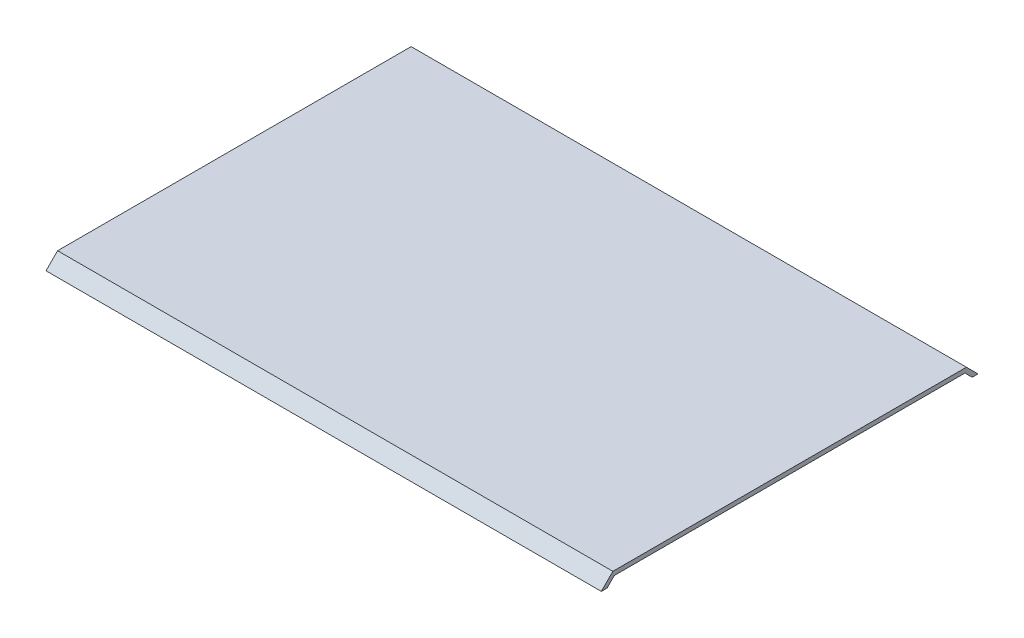
from build123d import *

# Parameters (mm, degrees)
BOSS_EXTRUDE1_DEPTH = 243.332
SKETCH2_W           = 114.3
SKETCH2_H           = 161.266666628
SKETCH2_W_2         = 78.232
SKETCH2_W_3         = 25.4
CUT_EXTRUDE1_DEPTH  = 3.175
CUT_EXTRUDE2_DEPTH  = 4.233333333
CHAMFER4_SIZE       = 0.635
CHAMFER3_SIZE       = 3.81
CHAMFER2_SIZE       = 5.08


# Some blends are built 0.0001 mm under size
with BuildPart() as part:
    # Sketch1 → Boss-Extrude1 (new body)
    with BuildSketch(Plane(origin=(0, 0, 0), x_dir=(0, 0, -1), z_dir=(1, 0, 0))):
        Polygon((-82.538333314, 2.54), (82.538333314, 2.54), (82.538333314, -2.54), (71.108333314, -2.54), (71.108333314, 0.635), (-71.108333314, 0.635), (-71.108333314, -2.54), (-82.538333314, -2.54), align=None)
    extrude(amount=BOSS_EXTRUDE1_DEPTH)

    # Sketch2 → Cut-Extrude1 (cut)
    with BuildSketch(Plane.XZ.offset(2.54)):
        with Locations((65.616666667, 0)):
            Rectangle(SKETCH2_W, SKETCH2_H)
        with Locations((170.349333333, 0)):
            Rectangle(SKETCH2_W_2, SKETCH2_H)
        with Locations((230.632, 0)):
            Rectangle(SKETCH2_W_3, SKETCH2_H)
    extrude(amount=-CUT_EXTRUDE1_DEPTH, mode=Mode.SUBTRACT)

    # Sketch4 → Cut-Extrude2 (cut)
    with BuildSketch(Plane.XZ.offset(2.54)):
        Polygon((4.233333333, 78.516666648), (7.408333333, 75.341666648), (4.233333333, 72.166666648), (1.058333333, 75.341666648), align=None)
        Polygon((210.523666667, 75.341666648), (213.698666667, 78.516666648), (216.873666667, 75.341666648), (213.698666667, 72.166666648), align=None)
        Polygon((123.825, 75.341666648), (127, 78.516666648), (130.175, 75.341666648), (127, 72.166666648), align=None)
        Polygon((1.058333333, -75.341666648), (4.233333333, -72.166666648), (7.408333333, -75.341666648), (4.233333333, -78.516666648), align=None)
        Polygon((123.825, -75.341666648), (127, -72.166666648), (130.175, -75.341666648), (127, -78.516666648), align=None)
        Polygon((210.523666667, -75.341666648), (213.698666667, -72.166666648), (216.873666667, -75.341666648), (213.698666667, -78.516666648), align=None)
    extrude(amount=-CUT_EXTRUDE2_DEPTH, mode=Mode.SUBTRACT)

    # Chamfer4
    chamfer4_edges = [part.edges().sort_by_distance(p)[0] for p in [
        (125.4125, 1.693333333, 73.754166648),
        (125.4125, 1.693333333, 76.929166648),
        (128.5875, 1.693333333, 76.929166648),
        (128.5875, 1.693333333, 73.754166648),
        (125.4125, -2.54, 73.754166648),
        (128.5875, -2.54, 73.754166648),
        (128.5875, -2.54, 76.929166648),
        (125.4125, -2.54, 76.929166648),
        (212.111166667, 1.693333333, 73.754166648),
        (212.111166667, 1.693333333, 76.929166648),
        (215.286166667, 1.693333333, 76.929166648),
        (215.286166667, 1.693333333, 73.754166648),
        (212.111166667, -2.54, 73.754166648),
        (215.286166667, -2.54, 73.754166648),
        (215.286166667, -2.54, 76.929166648),
        (212.111166667, -2.54, 76.929166648),
        (2.645833333, 1.693333333, -76.929166648),
        (2.645833333, 1.693333333, -73.754166648),
        (5.820833333, 1.693333333, -73.754166648),
        (5.820833333, 1.693333333, -76.929166648),
        (2.645833333, -2.54, -76.929166648),
        (5.820833333, -2.54, -76.929166648),
        (5.820833333, -2.54, -73.754166648),
        (2.645833333, -2.54, -73.754166648),
        (125.4125, 1.693333333, -76.929166648),
        (125.4125, 1.693333333, -73.754166648),
        (128.5875, 1.693333333, -73.754166648),
        (128.5875, 1.693333333, -76.929166648),
        (125.4125, -2.54, -76.929166648),
        (128.5875, -2.54, -76.929166648),
        (128.5875, -2.54, -73.754166648),
        (125.4125, -2.54, -73.754166648),
        (212.111166667, 1.693333333, -76.929166648),
        (212.111166667, 1.693333333, -73.754166648),
        (215.286166667, 1.693333333, -73.754166648),
        (215.286166667, 1.693333333, -76.929166648),
        (212.111166667, -2.54, -76.929166648),
        (215.286166667, -2.54, -76.929166648),
        (215.286166667, -2.54, -73.754166648),
        (212.111166667, -2.54, -73.754166648),
        (2.645833333, 1.693333333, 76.929166648),
        (5.820833333, 1.693333333, 76.929166648),
        (5.820833333, 1.693333333, 73.754166648),
        (2.645833333, 1.693333333, 73.754166648),
        (2.645833333, -2.54, 76.929166648),
        (2.645833333, -2.54, 73.754166648),
        (5.820833333, -2.54, 73.754166648),
        (5.820833333, -2.54, 76.929166648),
    ]]
    chamfer(chamfer4_edges, length=CHAMFER4_SIZE)

    # Chamfer3
    # the kernel refuses this chamfer: 3.81 mm, written as the material it adds along each edge
    with BuildSketch(Plane(origin=(132.564778851, 0.635, -80.633333314), x_dir=(0, 0.027495876610586334, 0.9996219169112968), z_dir=(-1, 0, 0))) as chamfer3_piece_1_section:
        Polygon((CHAMFER3_SIZE * 0.999621916911, -CHAMFER3_SIZE * 0.0274958766106), (-CHAMFER3_SIZE * 0.0274958766106, -CHAMFER3_SIZE * 0.999621916911), (0, 0), align=None)
    chamfer3_piece_1 = extrude(amount=133.896224368, mode=Mode.PRIVATE)
    chamfer3_piece_1 = split(chamfer3_piece_1, bisect_by=Plane(origin=(131.899056092, -2.54, -79.333095219), z_dir=(0, 1, 0)), keep=Keep.TOP, mode=Mode.PRIVATE)
    chamfer3_piece_1 = split(chamfer3_piece_1, bisect_by=Plane(origin=(129.04131376, -0.57452381, -76.475352887), z_dir=(0.7071067811865444, 0, -0.7071067811865507)), keep=Keep.TOP, mode=Mode.PRIVATE)
    add(chamfer3_piece_1)
    with BuildSketch(Plane(origin=(132.564778851, 0.635, -80.633333314), x_dir=(0, 0.027495876610586334, 0.9996219169112968), z_dir=(-1, 0, 0))) as chamfer3_piece_2_section:
        Polygon((CHAMFER3_SIZE * 0.999621916911, -CHAMFER3_SIZE * 0.0274958766106), (-CHAMFER3_SIZE * 0.0274958766106, -CHAMFER3_SIZE * 0.999621916911), (0, 0), align=None)
    chamfer3_piece_2 = extrude(amount=133.896224368, mode=Mode.PRIVATE)
    chamfer3_piece_2 = split(chamfer3_piece_2, bisect_by=Plane(origin=(65.616666667, -2.54, -79.333095219), z_dir=(0, 1, 0)), keep=Keep.TOP, mode=Mode.PRIVATE)
    chamfer3_piece_2 = split(chamfer3_piece_2, bisect_by=Plane(origin=(34.516785714, -0.57452381, -48.233214267), z_dir=(0.7071067811865476, 0, -0.7071067811865476)), keep=Keep.TOP, mode=Mode.PRIVATE)
    chamfer3_piece_2 = split(chamfer3_piece_2, bisect_by=Plane(origin=(96.716547619, -0.57452381, -48.233214267), z_dir=(-0.7071067811865444, 0, -0.7071067811865507)), keep=Keep.TOP, mode=Mode.PRIVATE)
    add(chamfer3_piece_2)
    with BuildSketch(Plane(origin=(219.263445517, 0.635, -80.633333314), x_dir=(0, 0.027495876610586334, 0.9996219169112968), z_dir=(-1, 0, 0))) as chamfer3_piece_3_section:
        Polygon((CHAMFER3_SIZE * 0.999621916911, -CHAMFER3_SIZE * 0.0274958766106), (-CHAMFER3_SIZE * 0.0274958766106, -CHAMFER3_SIZE * 0.999621916911), (0, 0), align=None)
    chamfer3_piece_3 = extrude(amount=97.828224368, mode=Mode.PRIVATE)
    chamfer3_piece_3 = split(chamfer3_piece_3, bisect_by=Plane(origin=(218.597722759, -2.54, -79.333095219), z_dir=(0, 1, 0)), keep=Keep.TOP, mode=Mode.PRIVATE)
    chamfer3_piece_3 = split(chamfer3_piece_3, bisect_by=Plane(origin=(215.739980427, -0.57452381, -76.475352887), z_dir=(0.7071067811865507, 0, -0.7071067811865444)), keep=Keep.TOP, mode=Mode.PRIVATE)
    add(chamfer3_piece_3)
    with BuildSketch(Plane(origin=(219.263445517, 0.635, -80.633333314), x_dir=(0, 0.027495876610586334, 0.9996219169112968), z_dir=(-1, 0, 0))) as chamfer3_piece_4_section:
        Polygon((CHAMFER3_SIZE * 0.999621916911, -CHAMFER3_SIZE * 0.0274958766106), (-CHAMFER3_SIZE * 0.0274958766106, -CHAMFER3_SIZE * 0.999621916911), (0, 0), align=None)
    chamfer3_piece_4 = extrude(amount=97.828224368, mode=Mode.PRIVATE)
    chamfer3_piece_4 = split(chamfer3_piece_4, bisect_by=Plane(origin=(170.349333333, -2.54, -79.333095219), z_dir=(0, 1, 0)), keep=Keep.TOP, mode=Mode.PRIVATE)
    chamfer3_piece_4 = split(chamfer3_piece_4, bisect_by=Plane(origin=(148.266452381, -0.57452381, -57.250214267), z_dir=(0.7071067811865444, 0, -0.7071067811865507)), keep=Keep.TOP, mode=Mode.PRIVATE)
    chamfer3_piece_4 = split(chamfer3_piece_4, bisect_by=Plane(origin=(192.432214286, -0.57452381, -57.250214267), z_dir=(-0.7071067811865507, 0, -0.7071067811865444)), keep=Keep.TOP, mode=Mode.PRIVATE)
    add(chamfer3_piece_4)
    with BuildSketch(Plane(origin=(219.263445517, 0.635, -80.633333314), x_dir=(0, 0.027495876610586334, 0.9996219169112968), z_dir=(-1, 0, 0))) as chamfer3_piece_5_section:
        Polygon((CHAMFER3_SIZE * 0.999621916911, -CHAMFER3_SIZE * 0.0274958766106), (-CHAMFER3_SIZE * 0.0274958766106, -CHAMFER3_SIZE * 0.999621916911), (0, 0), align=None)
    chamfer3_piece_5 = extrude(amount=97.828224368, mode=Mode.PRIVATE)
    chamfer3_piece_5 = split(chamfer3_piece_5, bisect_by=Plane(origin=(122.100943908, -2.54, -79.333095219), z_dir=(0, 1, 0)), keep=Keep.TOP, mode=Mode.PRIVATE)
    chamfer3_piece_5 = split(chamfer3_piece_5, bisect_by=Plane(origin=(124.95868624, -0.57452381, -76.475352887), z_dir=(-0.7071067811865444, 0, -0.7071067811865507)), keep=Keep.TOP, mode=Mode.PRIVATE)
    add(chamfer3_piece_5)
    with BuildSketch(Plane(origin=(243.332, 0.635, -80.633333314), x_dir=(0, 0.027495876610580335, 0.999621916911297), z_dir=(-1, 0, 0))) as chamfer3_piece_6_section:
        Polygon((CHAMFER3_SIZE * 0.999621916911, -CHAMFER3_SIZE * 0.0274958766106), (-CHAMFER3_SIZE * 0.0274958766106, -CHAMFER3_SIZE * 0.999621916911), (0, 0), align=None)
    chamfer3_piece_6 = extrude(amount=35.198112184, mode=Mode.PRIVATE)
    chamfer3_piece_6 = split(chamfer3_piece_6, bisect_by=Plane(origin=(230.632, -2.54, -79.333095219), z_dir=(0, 1, 0)), keep=Keep.TOP, mode=Mode.PRIVATE)
    chamfer3_piece_6 = split(chamfer3_piece_6, bisect_by=Plane(origin=(221.757119048, -0.57452381, -70.458214267), z_dir=(0.7071067811865507, 0, -0.7071067811865444)), keep=Keep.TOP, mode=Mode.PRIVATE)
    add(chamfer3_piece_6)
    with BuildSketch(Plane(origin=(253.130112184, 0.635, -80.633333314), x_dir=(0, 0.027495876610586334, 0.9996219169112968), z_dir=(-1, 0, 0))) as chamfer3_piece_7_section:
        Polygon((CHAMFER3_SIZE * 0.999621916911, -CHAMFER3_SIZE * 0.0274958766106), (-CHAMFER3_SIZE * 0.0274958766106, -CHAMFER3_SIZE * 0.999621916911), (0, 0), align=None)
    chamfer3_piece_7 = extrude(amount=44.996224368, mode=Mode.PRIVATE)
    chamfer3_piece_7 = split(chamfer3_piece_7, bisect_by=Plane(origin=(208.799610575, -2.54, -79.333095219), z_dir=(0, 1, 0)), keep=Keep.TOP, mode=Mode.PRIVATE)
    chamfer3_piece_7 = split(chamfer3_piece_7, bisect_by=Plane(origin=(211.657352906, -0.57452381, -76.475352887), z_dir=(-0.7071067811865507, 0, -0.7071067811865444)), keep=Keep.TOP, mode=Mode.PRIVATE)
    add(chamfer3_piece_7)
    with BuildSketch(Plane(origin=(208.133887816, 0.635, 80.633333314), x_dir=(0, -0.9996219169112968, 0.027495876610586382), z_dir=(1, 0, 0))) as chamfer3_piece_8_section:
        Polygon((CHAMFER3_SIZE * 0.999621916911, CHAMFER3_SIZE * 0.0274958766106), (-CHAMFER3_SIZE * 0.0274958766106, CHAMFER3_SIZE * 0.999621916911), (0, 0), align=None)
    chamfer3_piece_8 = extrude(amount=44.996224368, mode=Mode.PRIVATE)
    chamfer3_piece_8 = split(chamfer3_piece_8, bisect_by=Plane(origin=(208.799610575, -2.54, 79.333095219), z_dir=(0, 1, 0)), keep=Keep.TOP, mode=Mode.PRIVATE)
    chamfer3_piece_8 = split(chamfer3_piece_8, bisect_by=Plane(origin=(211.657352906, -0.57452381, 76.475352887), z_dir=(-0.7071067811865301, 0, 0.7071067811865649)), keep=Keep.TOP, mode=Mode.PRIVATE)
    add(chamfer3_piece_8)
    with BuildSketch(Plane(origin=(208.133887816, 0.635, 80.633333314), x_dir=(0, -0.9996219169112968, 0.027495876610586382), z_dir=(1, 0, 0))) as chamfer3_piece_9_section:
        Polygon((CHAMFER3_SIZE * 0.999621916911, CHAMFER3_SIZE * 0.0274958766106), (-CHAMFER3_SIZE * 0.0274958766106, CHAMFER3_SIZE * 0.999621916911), (0, 0), align=None)
    chamfer3_piece_9 = extrude(amount=35.198112184, mode=Mode.PRIVATE)
    chamfer3_piece_9 = split(chamfer3_piece_9, bisect_by=Plane(origin=(230.632, -2.54, 79.333095219), z_dir=(0, 1, 0)), keep=Keep.TOP, mode=Mode.PRIVATE)
    chamfer3_piece_9 = split(chamfer3_piece_9, bisect_by=Plane(origin=(221.757119048, -0.57452381, 70.458214267), z_dir=(0.7071067811865619, 0, 0.7071067811865334)), keep=Keep.TOP, mode=Mode.PRIVATE)
    add(chamfer3_piece_9)
    with BuildSketch(Plane(origin=(121.435221149, 0.635, 80.633333314), x_dir=(0, -0.9996219169112968, 0.027495876610586382), z_dir=(1, 0, 0))) as chamfer3_piece_10_section:
        Polygon((CHAMFER3_SIZE * 0.999621916911, CHAMFER3_SIZE * 0.0274958766106), (-CHAMFER3_SIZE * 0.0274958766106, CHAMFER3_SIZE * 0.999621916911), (0, 0), align=None)
    chamfer3_piece_10 = extrude(amount=97.828224368, mode=Mode.PRIVATE)
    chamfer3_piece_10 = split(chamfer3_piece_10, bisect_by=Plane(origin=(122.100943908, -2.54, 79.333095219), z_dir=(0, 1, 0)), keep=Keep.TOP, mode=Mode.PRIVATE)
    chamfer3_piece_10 = split(chamfer3_piece_10, bisect_by=Plane(origin=(124.95868624, -0.57452381, 76.475352887), z_dir=(-0.7071067811865476, 0, 0.7071067811865476)), keep=Keep.TOP, mode=Mode.PRIVATE)
    add(chamfer3_piece_10)
    with BuildSketch(Plane(origin=(121.435221149, 0.635, 80.633333314), x_dir=(0, -0.9996219169112968, 0.027495876610586382), z_dir=(1, 0, 0))) as chamfer3_piece_11_section:
        Polygon((CHAMFER3_SIZE * 0.999621916911, CHAMFER3_SIZE * 0.0274958766106), (-CHAMFER3_SIZE * 0.0274958766106, CHAMFER3_SIZE * 0.999621916911), (0, 0), align=None)
    chamfer3_piece_11 = extrude(amount=97.828224368, mode=Mode.PRIVATE)
    chamfer3_piece_11 = split(chamfer3_piece_11, bisect_by=Plane(origin=(170.349333333, -2.54, 79.333095219), z_dir=(0, 1, 0)), keep=Keep.TOP, mode=Mode.PRIVATE)
    chamfer3_piece_11 = split(chamfer3_piece_11, bisect_by=Plane(origin=(148.266452381, -0.57452381, 57.250214267), z_dir=(0.7071067811865459, 0, 0.7071067811865491)), keep=Keep.TOP, mode=Mode.PRIVATE)
    chamfer3_piece_11 = split(chamfer3_piece_11, bisect_by=Plane(origin=(192.432214286, -0.57452381, 57.250214267), z_dir=(-0.7071067811865301, 0, 0.7071067811865649)), keep=Keep.TOP, mode=Mode.PRIVATE)
    add(chamfer3_piece_11)
    with BuildSketch(Plane(origin=(121.435221149, 0.635, 80.633333314), x_dir=(0, -0.9996219169112968, 0.027495876610586382), z_dir=(1, 0, 0))) as chamfer3_piece_12_section:
        Polygon((CHAMFER3_SIZE * 0.999621916911, CHAMFER3_SIZE * 0.0274958766106), (-CHAMFER3_SIZE * 0.0274958766106, CHAMFER3_SIZE * 0.999621916911), (0, 0), align=None)
    chamfer3_piece_12 = extrude(amount=97.828224368, mode=Mode.PRIVATE)
    chamfer3_piece_12 = split(chamfer3_piece_12, bisect_by=Plane(origin=(218.597722759, -2.54, 79.333095219), z_dir=(0, 1, 0)), keep=Keep.TOP, mode=Mode.PRIVATE)
    chamfer3_piece_12 = split(chamfer3_piece_12, bisect_by=Plane(origin=(215.739980427, -0.57452381, 76.475352887), z_dir=(0.7071067811865619, 0, 0.7071067811865334)), keep=Keep.TOP, mode=Mode.PRIVATE)
    add(chamfer3_piece_12)
    with BuildSketch(Plane(origin=(-1.331445517, 0.635, 80.633333314), x_dir=(0, -0.9996219169112968, 0.027495876610586382), z_dir=(1, 0, 0))) as chamfer3_piece_13_section:
        Polygon((CHAMFER3_SIZE * 0.999621916911, CHAMFER3_SIZE * 0.0274958766106), (-CHAMFER3_SIZE * 0.0274958766106, CHAMFER3_SIZE * 0.999621916911), (0, 0), align=None)
    chamfer3_piece_13 = extrude(amount=133.896224368, mode=Mode.PRIVATE)
    chamfer3_piece_13 = split(chamfer3_piece_13, bisect_by=Plane(origin=(65.616666667, -2.54, 79.333095219), z_dir=(0, 1, 0)), keep=Keep.TOP, mode=Mode.PRIVATE)
    chamfer3_piece_13 = split(chamfer3_piece_13, bisect_by=Plane(origin=(96.716547619, -0.57452381, 48.233214267), z_dir=(-0.7071067811865476, 0, 0.7071067811865476)), keep=Keep.TOP, mode=Mode.PRIVATE)
    chamfer3_piece_13 = split(chamfer3_piece_13, bisect_by=Plane(origin=(34.516785714, -0.57452381, 48.233214267), z_dir=(0.7071067811865476, 0, 0.7071067811865476)), keep=Keep.TOP, mode=Mode.PRIVATE)
    add(chamfer3_piece_13)
    with BuildSketch(Plane(origin=(-1.331445517, 0.635, 80.633333314), x_dir=(0, -0.9996219169112968, 0.027495876610586382), z_dir=(1, 0, 0))) as chamfer3_piece_14_section:
        Polygon((CHAMFER3_SIZE * 0.999621916911, CHAMFER3_SIZE * 0.0274958766106), (-CHAMFER3_SIZE * 0.0274958766106, CHAMFER3_SIZE * 0.999621916911), (0, 0), align=None)
    chamfer3_piece_14 = extrude(amount=133.896224368, mode=Mode.PRIVATE)
    chamfer3_piece_14 = split(chamfer3_piece_14, bisect_by=Plane(origin=(131.899056092, -2.54, 79.333095219), z_dir=(0, 1, 0)), keep=Keep.TOP, mode=Mode.PRIVATE)
    chamfer3_piece_14 = split(chamfer3_piece_14, bisect_by=Plane(origin=(129.04131376, -0.57452381, 76.475352887), z_dir=(0.7071067811865459, 0, 0.7071067811865491)), keep=Keep.TOP, mode=Mode.PRIVATE)
    add(chamfer3_piece_14)

    # Chamfer2
    chamfer2_edges = [part.edges().sort_by_distance(p)[0] for p in [
        (121.666, 2.54, 82.538333314),
        (121.666, 2.54, -82.538333314),
    ]]
    chamfer(chamfer2_edges, length=CHAMFER2_SIZE - 0.0001)  # a hair under: the kernel refuses the full size


solid = part.part
